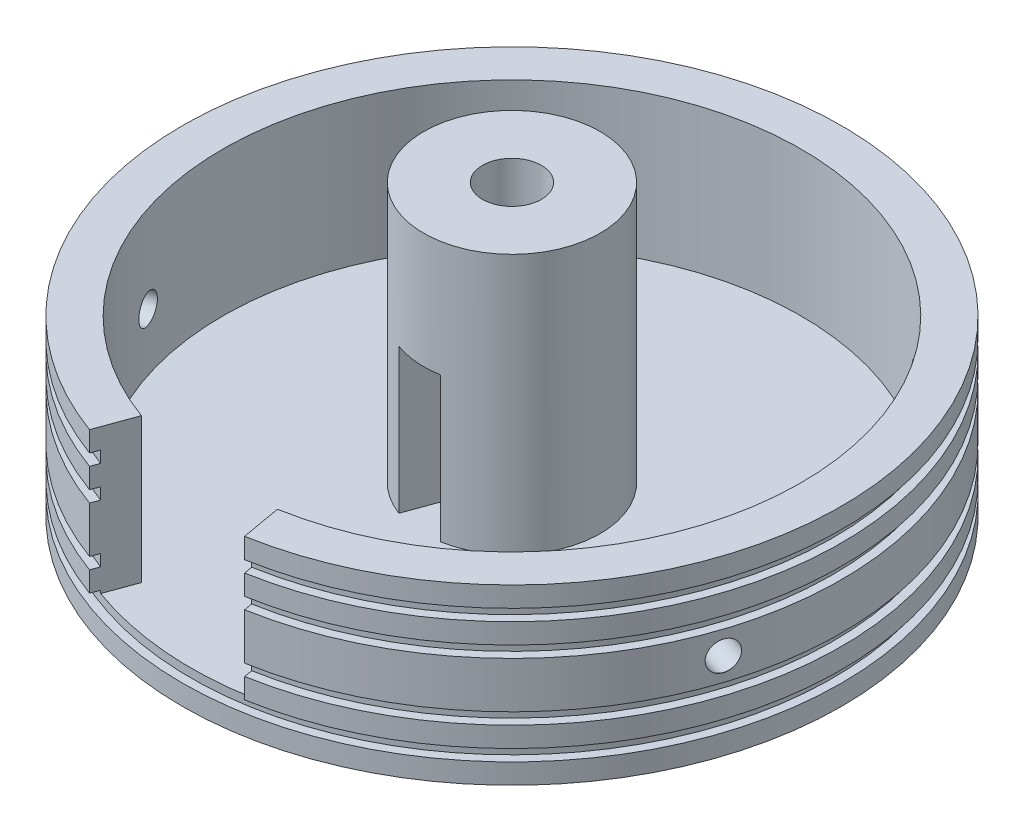
from build123d import *

# Parameters (mm, degrees)
CIRPATTERN1_COUNT  = 5
M12_TAPPED_HOLE1_D = 10.2
CUT_EXTRUDE1_START = 5
CUT_EXTRUDE1_DEPTH = 25


# Read off the part's stored shape, not the designer's step: M5 Tapped Hole1
with BuildPart() as part:
    # Sketch1 → Revolve1 (revolve)
    with BuildSketch(Plane.XY, mode=Mode.PRIVATE) as revolve1_sk:
        Polygon((0, 0), (0, 50), (15.25, 50), (15.25, 5), (50, 5), (50, 30), (57, 30), (57, 26.5), (55.5, 26.5), (55.5, 24.5), (57, 24.5), (57, 21), (55.5, 21), (55.5, 19), (57, 19), (57, 11), (55.5, 11), (55.5, 9), (57, 9), (57, 5.5), (55.5, 5.5), (55.5, 3.5), (57, 3.5), (57, 0), align=None)
    revolve(revolve1_sk.sketch.rotate(Axis((0, 0, 0), (0, 1, 0)), 90), axis=Axis((0, 0, 0), (0, 1, 0)))

    # M5 Tapped Hole1 outline → M5 Tapped Hole1 (revolve, cut)
    with BuildSketch(Plane.XZ.offset(-15)):
        Polygon((2.5, 57.000021797), (2.5, 56.975), (2.525021794, 57.000021794), align=None)
        Polygon((2.5, 49.93742724), (2.5, 56.975), (2.5, 57.000021797), (0, 57.000021797), (0, 49.93742724), align=None)
    m5_tapped_hole1 = revolve(axis=Axis((0, 15, 0), (0, 0, 1)), mode=Mode.SUBTRACT)

    # CirPattern1: M5 Tapped Hole1 ×5 about axis
    cirpattern1_axis = Axis((0, 0, 0), (0, -1, 0))
    for i in range(1, CIRPATTERN1_COUNT):
        add(m5_tapped_hole1.rotate(cirpattern1_axis, i * 360 / CIRPATTERN1_COUNT), mode=Mode.SUBTRACT)

    # M12 Tapped Hole1 (through all)
    with Locations(Plane.XZ):
        with Locations((0, 0)):
            Hole(M12_TAPPED_HOLE1_D / 2)

    # Sketch6 → Cut-Extrude1 (cut)
    with BuildSketch(Plane(origin=(0, 0, 0), x_dir=(1, 0, 0), z_dir=(0, 1, 0)).offset(CUT_EXTRUDE1_START)):
        with BuildLine():
            Line((0, 0), (9.897946127, -56.134041922))
            ThreePointArc((9.897946127, -56.134041922), (-4.967877337, -56.783097791), (-19.49514817, -53.562479385))
            Line((-19.49514817, -53.562479385), (0, 0))
        make_face()
    extrude(amount=CUT_EXTRUDE1_DEPTH, mode=Mode.SUBTRACT)


solid = part.part
